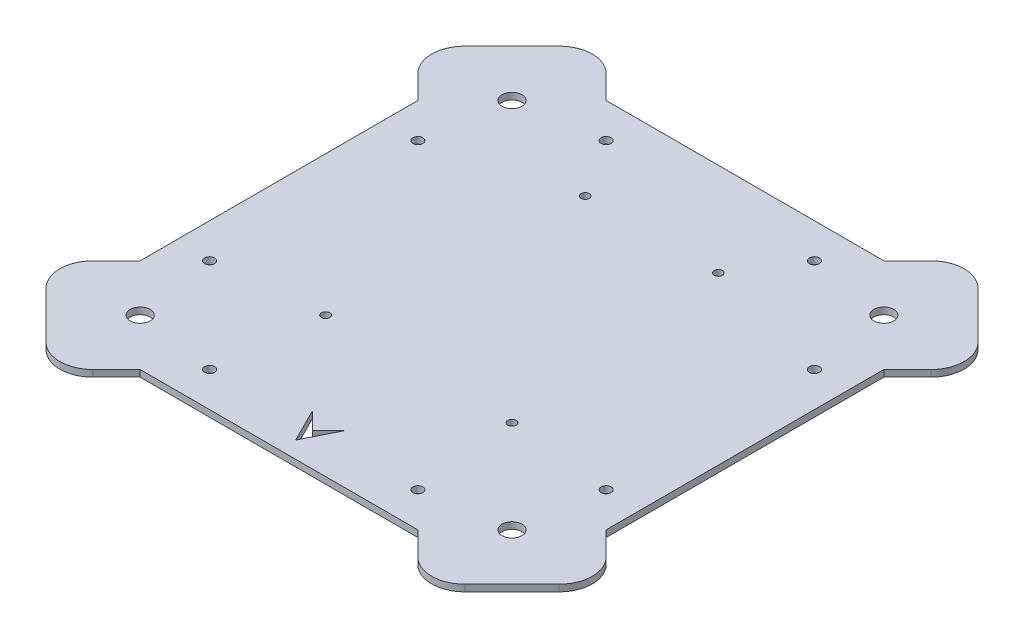
from build123d import *

# Parameters (mm, degrees)
SKETCH1_W           = 140
SKETCH1_H           = 140
BOSS_EXTRUDE1_DEPTH = 2
BOSS_EXTRUDE3_DEPTH = 2
FILLET1_R           = 10
SKETCH4_R           = 1.5
CUT_EXTRUDE2_DEPTH  = 2
SKETCH5_R           = 3
CUT_EXTRUDE3_DEPTH  = 10
SKETCH6_R           = 1.25
CUT_EXTRUDE4_DEPTH  = 15
CUT_EXTRUDE5_DEPTH  = 2


with BuildPart() as part:
    # Sketch1 → Boss-Extrude1 (new body)
    with BuildSketch(Plane(origin=(0, 0, 0), x_dir=(1, 0, 0), z_dir=(0, 1, 0))):
        with Locations((70, 70)):
            Rectangle(SKETCH1_W, SKETCH1_H)
    extrude(amount=BOSS_EXTRUDE1_DEPTH)

    # Sketch2 → Boss-Extrude3 (add)
    with BuildSketch(Plane(origin=(0, 2, 0), x_dir=(1, 0, 0), z_dir=(0, 1, 0))):
        Polygon((111.715728753, 140), (140, 111.715728753), (154.142135624, 125.857864376), (125.857864376, 154.142135624), align=None)
        Polygon((0, 111.715728753), (-14.142135624, 125.857864376), (14.142135624, 154.142135624), (28.284271247, 140), align=None)
        Polygon((28.284271247, 0), (0, 28.284271247), (-14.142135624, 14.142135624), (14.142135624, -14.142135624), align=None)
        Polygon((140, 28.284271247), (154.142135624, 14.142135624), (125.857864376, -14.142135624), (111.715728753, 0), align=None)
    extrude(amount=-BOSS_EXTRUDE3_DEPTH)

    # Fillet1
    fillet1_edges = [part.edges().sort_by_distance(p)[0] for p in [
        (154.142135624, 1, -14.142135624),
        (125.857864376, 1, 14.142135624),
        (14.142135624, 1, 14.142135624),
        (-14.142135624, 1, -14.142135624),
        (-14.142135624, 1, -125.857864376),
        (14.142135624, 1, -154.142135624),
        (125.857864376, 1, -154.142135624),
        (154.142135624, 1, -125.857864376),
    ]]
    fillet(fillet1_edges, radius=FILLET1_R)

    # Sketch4 → Cut-Extrude2 (cut)
    with BuildSketch(Plane(origin=(0, 2, 0), x_dir=(1, 0, 0), z_dir=(0, 1, 0))):
        with Locations((38.717631804, 10.433360556)):
            Circle(SKETCH4_R)
        with Locations((10.433360556, 38.717631804)):
            Circle(SKETCH4_R)
        with Locations((101.282368196, 10.433360556)):
            Circle(SKETCH4_R)
        with Locations((129.566639444, 38.717631804)):
            Circle(SKETCH4_R)
        with Locations((38.717631804, 129.566639444)):
            Circle(SKETCH4_R)
        with Locations((10.433360556, 101.282368196)):
            Circle(SKETCH4_R)
        with Locations((101.282368196, 129.566639444)):
            Circle(SKETCH4_R)
        with Locations((129.566639444, 101.282368196)):
            Circle(SKETCH4_R)
    extrude(amount=-CUT_EXTRUDE2_DEPTH, mode=Mode.SUBTRACT)

    # Sketch5 → Cut-Extrude3 (cut)
    with BuildSketch(Plane(origin=(0, 2, 0), x_dir=(1, 0, 0), z_dir=(0, 1, 0))):
        with Locations((14.142135624, 14.142135624)):
            Circle(SKETCH5_R)
        with Locations((125.857864376, 14.142135624)):
            Circle(SKETCH5_R)
        with Locations((14.142135624, 125.857864376)):
            Circle(SKETCH5_R)
        with Locations((125.857864376, 125.857864376)):
            Circle(SKETCH5_R)
    extrude(amount=-CUT_EXTRUDE3_DEPTH, mode=Mode.SUBTRACT)

    # Sketch6 → Cut-Extrude4 (cut)
    with BuildSketch(Plane(origin=(0, 2, 0), x_dir=(1, 0, 0), z_dir=(0, 1, 0))):
        with Locations((90, 111.999971357)):
            Circle(SKETCH6_R)
        with Locations((98, 41.999971357)):
            Circle(SKETCH6_R)
        with Locations((42, 41.999971357)):
            Circle(SKETCH6_R)
        with Locations((50, 111.999971357)):
            Circle(SKETCH6_R)
    extrude(amount=-CUT_EXTRUDE4_DEPTH, mode=Mode.SUBTRACT)

    # Sketch7 → Cut-Extrude5 (cut)
    with BuildSketch(Plane(origin=(0, 2, 0), x_dir=(1, 0, 0), z_dir=(0, 1, 0))):
        Polygon((75, 15), (70, 5), (65, 15), (70, 10), align=None)
    extrude(amount=-CUT_EXTRUDE5_DEPTH, mode=Mode.SUBTRACT)


solid = part.part
